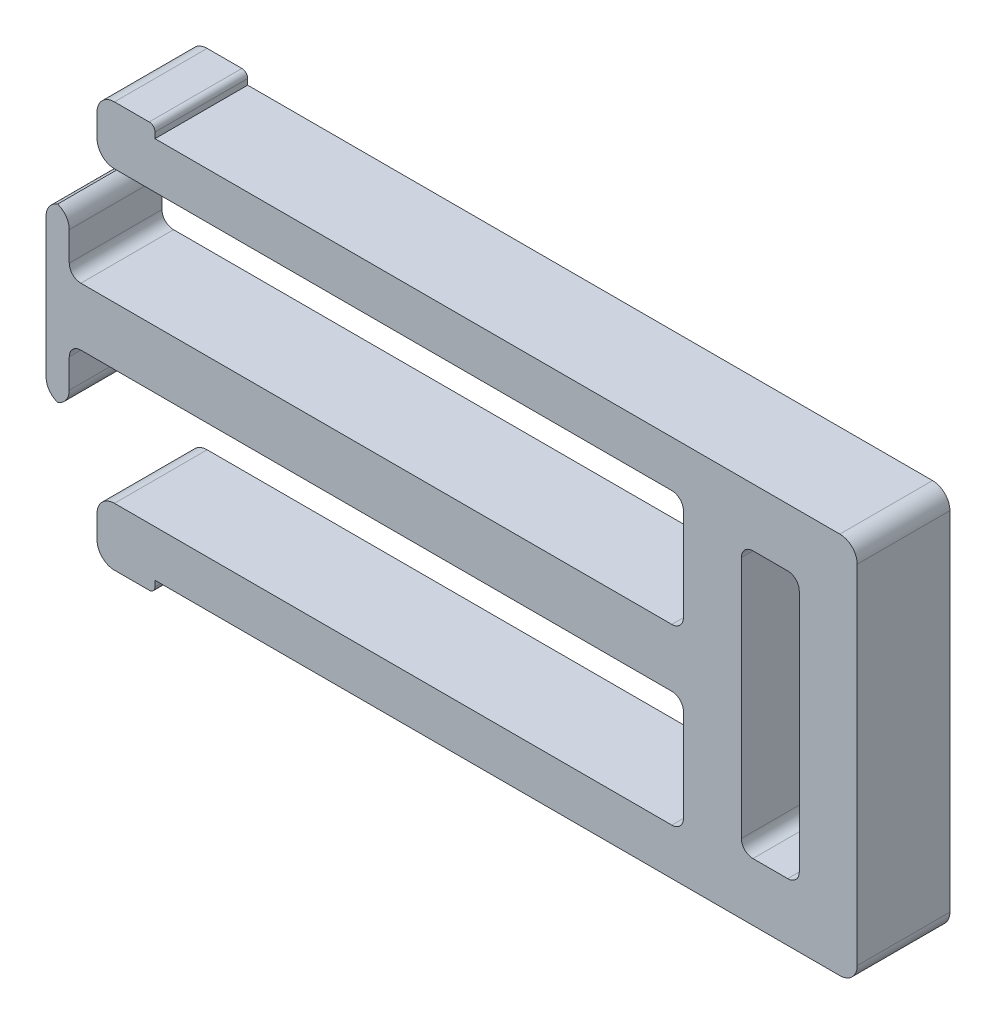
from build123d import *

# Parameters (mm, degrees)
SKETCH1_W           = 23
SKETCH1_H           = 5
BOSS_EXTRUDE2_DEPTH = 8
FILLET1_R           = 1
FILLET2_R           = 0.5
FILLET3_R           = 1.5


with BuildPart() as part:
    # Sketch1 → Boss-Extrude2 (new body)
    with BuildSketch(Plane(origin=(0, 0, 0), x_dir=(0, 1, 0), z_dir=(0, 0, 1))):
        Polygon((0, 0), (-33, 0), (-33, 60.6), (-34, 60.6), (-34, 65.6), (-29, 65.6), (-29, 15), (-19, 15), (-19, 68), (-24, 68), (-24, 70), (-9, 70), (-9, 68), (-14, 68), (-14, 15), (-4, 15), (-4, 65.6), (1, 65.6), (1, 60.6), (0, 60.6), align=None)
        with Locations((-16.5, 7.5)):
            Rectangle(SKETCH1_W, SKETCH1_H, mode=Mode.SUBTRACT)
    extrude(amount=BOSS_EXTRUDE2_DEPTH)

    # Fillet1
    fillet1_edges = [part.edges().sort_by_distance(p)[0] for p in [
        (-15, -29, 4),
        (-15, -19, 4),
        (-68, -19, 4),
        (-68, -14, 4),
        (-15, -14, 4),
        (-15, -4, 4),
        (-10, -5, 4),
        (-10, -28, 4),
        (-5, -28, 4),
        (-5, -5, 4),
    ]]
    fillet(fillet1_edges, radius=FILLET1_R)

    # Fillet2
    fillet2_edges = [part.edges().sort_by_distance(p)[0] for p in [
        (-60.6, -34, 4),
        (-60.6, 1, 4),
    ]]
    fillet(fillet2_edges, radius=FILLET2_R)

    # Fillet3
    # the kernel refuses this fillet: 1.5 mm, written as the material it takes off along each edge
    with BuildSketch(Plane(origin=(-70, -24, -3.75), x_dir=(1, 0, 0), z_dir=(0, 0, 1)), Plane(origin=(-70, -9, -3.75), x_dir=(0, -1, 0), z_dir=(0, 0, 1)), Plane(origin=(-68, -9, -3.75), x_dir=(-1, 0, 0), z_dir=(0, 0, 1)), Plane(origin=(-68, -24, -3.75), x_dir=(0, 1, 0), z_dir=(0, 0, 1)), Plane(origin=(-65.6, -29, -3.75), x_dir=(0, -1, 0), z_dir=(0, 0, 1)), Plane(origin=(-65.6, -34, -3.75), x_dir=(1, 0, 0), z_dir=(0, 0, 1))) as fillet3_piece_1:
        with BuildLine():
            CenterArc((FILLET3_R, FILLET3_R), FILLET3_R, 180, 90)
            Line((0, FILLET3_R), (0, 0))
            Line((0, 0), (FILLET3_R, 0))
        make_face()
    extrude(amount=15.5, mode=Mode.SUBTRACT)
    with BuildSketch(Plane(origin=(0, -33, -3.75), x_dir=(-1, 0, 0), z_dir=(0, 0, 1)), Plane(origin=(0, 0, -3.75), x_dir=(0, -1, 0), z_dir=(0, 0, 1)), Plane(origin=(-65.6, 1, -3.75), x_dir=(1, 0, 0), z_dir=(0, 0, 1)), Plane(origin=(-65.6, -4, -3.75), x_dir=(0, 1, 0), z_dir=(0, 0, 1))) as fillet3_piece_2:
        with BuildLine():
            CenterArc((FILLET3_R, -FILLET3_R), FILLET3_R, 90, 90)
            Line((0, -FILLET3_R), (0, 0))
            Line((0, 0), (FILLET3_R, 0))
        make_face()
    extrude(amount=15.5, mode=Mode.SUBTRACT)


solid = part.part
